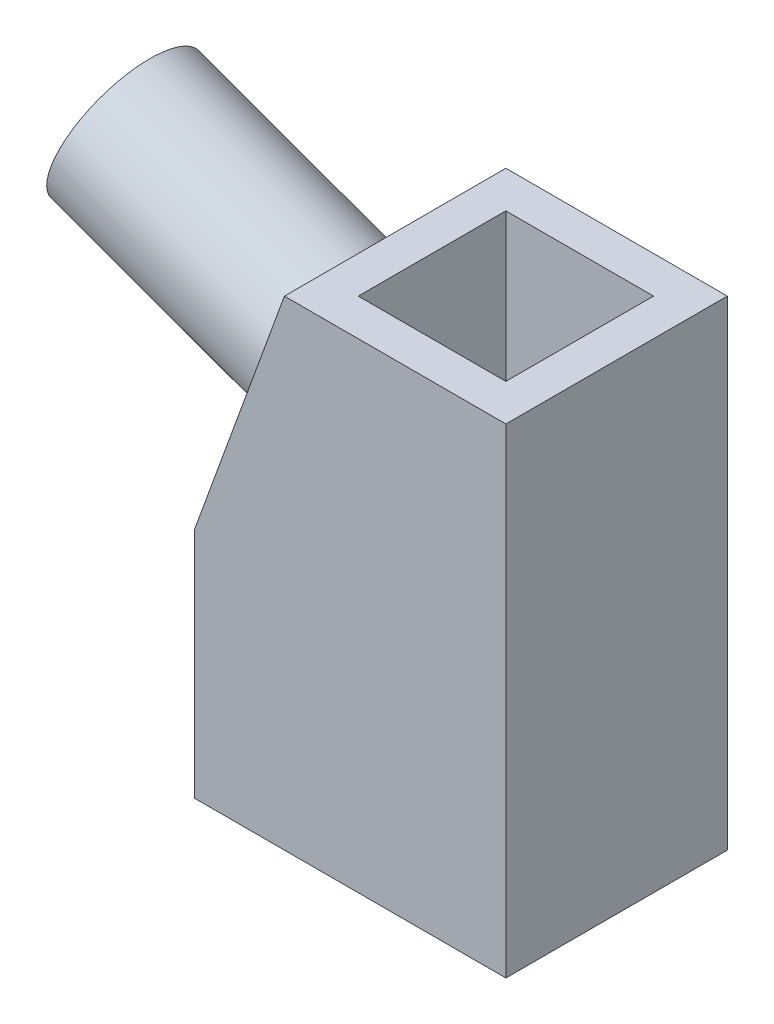
from build123d import *

# Parameters (mm, degrees)
SKETCH1_W           = 53.594
SKETCH1_H           = 38.1
BOSS_EXTRUDE1_DEPTH = 82.55
CUT_EXTRUDE1_DEPTH  = 106.538757506
SKETCH5_W           = 25.4
SKETCH5_H           = 25.4
CUT_EXTRUDE2_DEPTH  = 106.538757506
SKETCH6_R           = 12.7
BOSS_EXTRUDE2_DEPTH = 41.275


with BuildPart() as part:
    # Sketch1 → Boss-Extrude1 (new body)
    with BuildSketch(Plane(origin=(0, 0, 0), x_dir=(1, 0, 0), z_dir=(0, 1, 0))):
        with Locations((26.797, 19.05)):
            Rectangle(SKETCH1_W, SKETCH1_H)
    extrude(amount=BOSS_EXTRUDE1_DEPTH)

    # Sketch4 → Cut-Extrude1 (cut, through all)
    with BuildSketch(Plane.XY):
        Polygon((0, 39.980584863), (15.494, 82.55), (0, 82.55), align=None)
    extrude(amount=-CUT_EXTRUDE1_DEPTH, mode=Mode.SUBTRACT)

    # Sketch5 → Cut-Extrude2 (cut, through all)
    with BuildSketch(Plane(origin=(0, 82.55, 0), x_dir=(1, 0, 0), z_dir=(0, 1, 0))):
        with Locations((34.544, 19.05)):
            Rectangle(SKETCH5_W, SKETCH5_H)
    extrude(amount=-CUT_EXTRUDE2_DEPTH, mode=Mode.SUBTRACT)

    # Sketch6 → Boss-Extrude2 (add)
    with BuildSketch(Plane(origin=(-12.849512289, 4.676839998, 0), x_dir=(0, 0, 1), z_dir=(-0.9396926207859096, 0.3420201433256656, 0))):
        with Locations((-19.05, 60.220173259)):
            Circle(SKETCH6_R)
    extrude(amount=BOSS_EXTRUDE2_DEPTH)


solid = part.part
